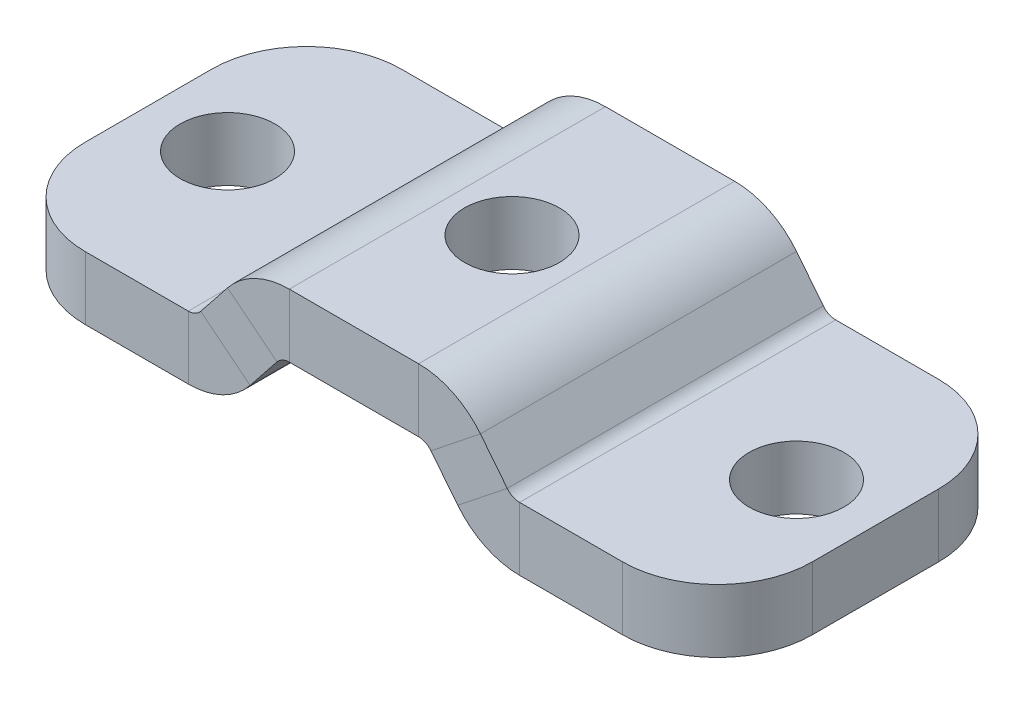
from build123d import *

# Parameters (mm, degrees)
MAIN_BODY_DEPTH         = 5
CONVERT_SOLID1_START    = -5
CONVERT_SOLID1_DEPTH    = 10
CONVERT_SOLID1_2_DEPTH  = 10
SKETCH6_R               = 1.5
MIDDLE_RIVET_HOLE_DEPTH = 14.224598293
SKETCH7_R               = 1.5
LEFT_RIVET_HOLE_DEPTH   = 13.731457104
FILLET1_R               = 3


# Read off the part's stored shape, not the designer's step: Convert-Solid1
with BuildPart() as part:
    # Sketch1 → MAIN BODY (new, symmetric)
    with BuildSketch(Plane.XY):
        Polygon((11.5, 0), (5, 0), (3.25, 2.2), (0, 2.2), (0, 0.2), (2.285328582, 0.2), (4.035328582, -2), (11.5, -2), align=None)
    main_body = extrude(amount=MAIN_BODY_DEPTH, both=True)

    # Mirror1: MAIN BODY across plane
    add(main_body.mirror(Plane(origin=(0, 0, 0), x_dir=(0, 0, 1), z_dir=(1, 0, 0))))

    # Convert-Solid1 outline → Convert-Solid1 (cut)
    with BuildSketch(Plane.XY.offset(CONVERT_SOLID1_START)):
        with BuildLine():
            ThreePointArc((-4.000663363, 1.256308915), (-3.130261025, 1.951751794), (-2.044160728, 2.2))
            Line((-2.044160728, 2.2), (-3.25, 2.2))
            Line((-3.25, 2.2), (-4.000663363, 1.256308915))
        make_face()
        with BuildLine():
            ThreePointArc((2.044160728, 2.2), (3.130261025, 1.951751794), (4.000663363, 1.256308915))
            Line((4.000663363, 1.256308915), (3.25, 2.2))
            Line((3.25, 2.2), (2.044160728, 2.2))
        make_face()
        with BuildLine():
            Line((-4.035328582, -2), (-3.284665219, -1.056308915))
            ThreePointArc((-3.284665219, -1.056308915), (-4.155067557, -1.751751794), (-5.241167854, -2))
            Line((-5.241167854, -2), (-4.035328582, -2))
        make_face()
        with BuildLine():
            ThreePointArc((5.241167854, -2), (4.155067557, -1.751751794), (3.284665219, -1.056308915))
            Line((3.284665219, -1.056308915), (4.035328582, -2))
            Line((4.035328582, -2), (5.241167854, -2))
        make_face()
    extrude(amount=CONVERT_SOLID1_DEPTH, mode=Mode.SUBTRACT)

    # Convert-Solid1 2 outline → Convert-Solid1 2 (add)
    with BuildSketch(Plane.XY.offset(CONVERT_SOLID1_START)):
        with BuildLine():
            Line((-5, 0), (-4.849867327, 0.188738217))
            ThreePointArc((-4.849867327, 0.188738217), (-5.023947795, 0.049649641), (-5.241167854, 0))
            Line((-5.241167854, 0), (-5, 0))
        make_face()
        with BuildLine():
            ThreePointArc((5.241167854, 0), (5.023947795, 0.049649641), (4.849867327, 0.188738217))
            Line((4.849867327, 0.188738217), (5, 0))
            Line((5, 0), (5.241167854, 0))
        make_face()
        with BuildLine():
            ThreePointArc((-2.435461255, 0.011261783), (-2.261380788, 0.150350359), (-2.044160728, 0.2))
            Line((-2.044160728, 0.2), (-2.285328582, 0.2))
            Line((-2.285328582, 0.2), (-2.435461255, 0.011261783))
        make_face()
        with BuildLine():
            ThreePointArc((2.044160728, 0.2), (2.261380788, 0.150350359), (2.435461255, 0.011261783))
            Line((2.435461255, 0.011261783), (2.285328582, 0.2))
            Line((2.285328582, 0.2), (2.044160728, 0.2))
        make_face()
    extrude(amount=CONVERT_SOLID1_2_DEPTH)

    # Sketch6 → MIDDLE RIVET HOLE (cut, through all)
    with BuildSketch(Plane(origin=(0, 2.2, 0), x_dir=(1, 0, 0), z_dir=(0, 1, 0))):
        with Locations(Location((0, 0, 0), (0, 0, 180))):
            Circle(SKETCH6_R)
    extrude(amount=-MIDDLE_RIVET_HOLE_DEPTH, mode=Mode.SUBTRACT)

    # Sketch7 → LEFT RIVET HOLE (cut, through all)
    with BuildSketch(Plane(origin=(0, 0, 0), x_dir=(1, 0, 0), z_dir=(0, 1, 0))):
        with Locations(Location((-9, 0, 0), (0, 0, 180))):
            Circle(SKETCH7_R)
    left_rivet_hole = extrude(amount=-LEFT_RIVET_HOLE_DEPTH, mode=Mode.SUBTRACT)

    # RIGHT RIVET HOLE: LEFT RIVET HOLE across plane
    add(left_rivet_hole.mirror(Plane(origin=(0, 0, 0), x_dir=(0, 0, 1), z_dir=(1, 0, 0))), mode=Mode.SUBTRACT)

    # Fillet1
    fillet1_edges = [part.edges().sort_by_distance(p)[0] for p in [
        (11.5, -1, -5),
        (11.5, -1, 5),
        (-11.5, -1, 5),
        (-11.5, -1, -5),
    ]]
    fillet(fillet1_edges, radius=FILLET1_R)


solid = part.part
